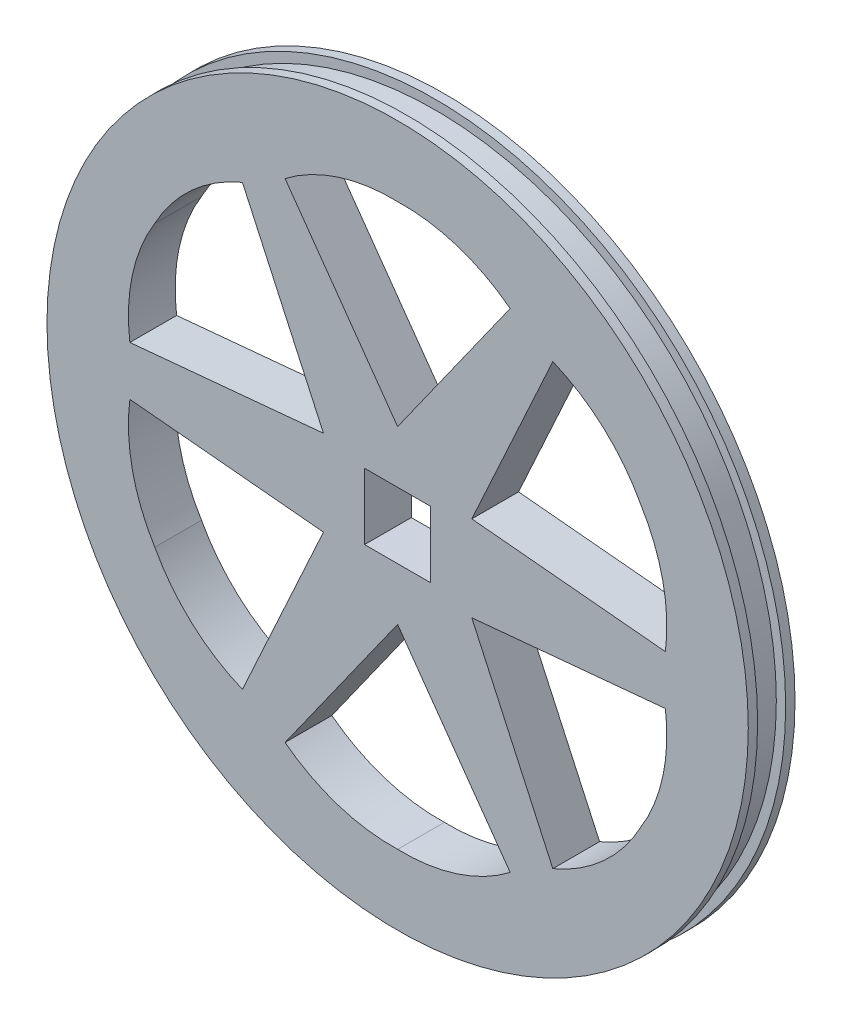
from build123d import *

# Parameters (mm, degrees)
SKETCH1_R           = 37.5
SKETCH1_W           = 7.071067812
SKETCH1_H           = 7.071067812
BOSS_EXTRUDE1_DEPTH = 2.5
CUT_EXTRUDE1_DEPTH  = 4
CIRPATTERN1_COUNT   = 6
SKETCH3_R           = 37.5
SKETCH3_R_2         = 36.5
CUT_EXTRUDE2_DEPTH  = 1.5


with BuildPart() as part:
    # Sketch1 → Boss-Extrude1 (new, symmetric)
    with BuildSketch(Plane.XY):
        Circle(SKETCH1_R)
        Rectangle(SKETCH1_W, SKETCH1_H, mode=Mode.SUBTRACT)
    extrude(amount=BOSS_EXTRUDE1_DEPTH, both=True)

    # Sketch2 → Cut-Extrude1 (cut, symmetric)
    with BuildSketch(Plane.XY):
        with BuildLine():
            Line((0, 9.158641407), (-12.037071564, 26.115211784))
            ThreePointArc((-12.037071564, 26.115211784), (-6.351662121, 29.087034336), (0, 29.988143709))
            ThreePointArc((0, 29.988143709), (6.351662121, 29.087034336), (12.037071564, 26.115211784))
            Line((12.037071564, 26.115211784), (0, 9.158641407))
        make_face()
    cut_extrude1 = extrude(amount=CUT_EXTRUDE1_DEPTH, both=True, mode=Mode.SUBTRACT)

    # CirPattern1: Cut-Extrude1 ×6 about axis
    cirpattern1_axis = Axis((0, 0, 2.5), (0, 0, -1))
    for i in range(1, CIRPATTERN1_COUNT):
        add(cut_extrude1.rotate(cirpattern1_axis, i * 360 / CIRPATTERN1_COUNT), mode=Mode.SUBTRACT)

    # Sketch3 → Cut-Extrude2 (cut, symmetric)
    with BuildSketch(Plane.XY):
        Circle(SKETCH3_R)
        Circle(SKETCH3_R_2, mode=Mode.SUBTRACT)
    extrude(amount=CUT_EXTRUDE2_DEPTH, both=True, mode=Mode.SUBTRACT)


solid = part.part
